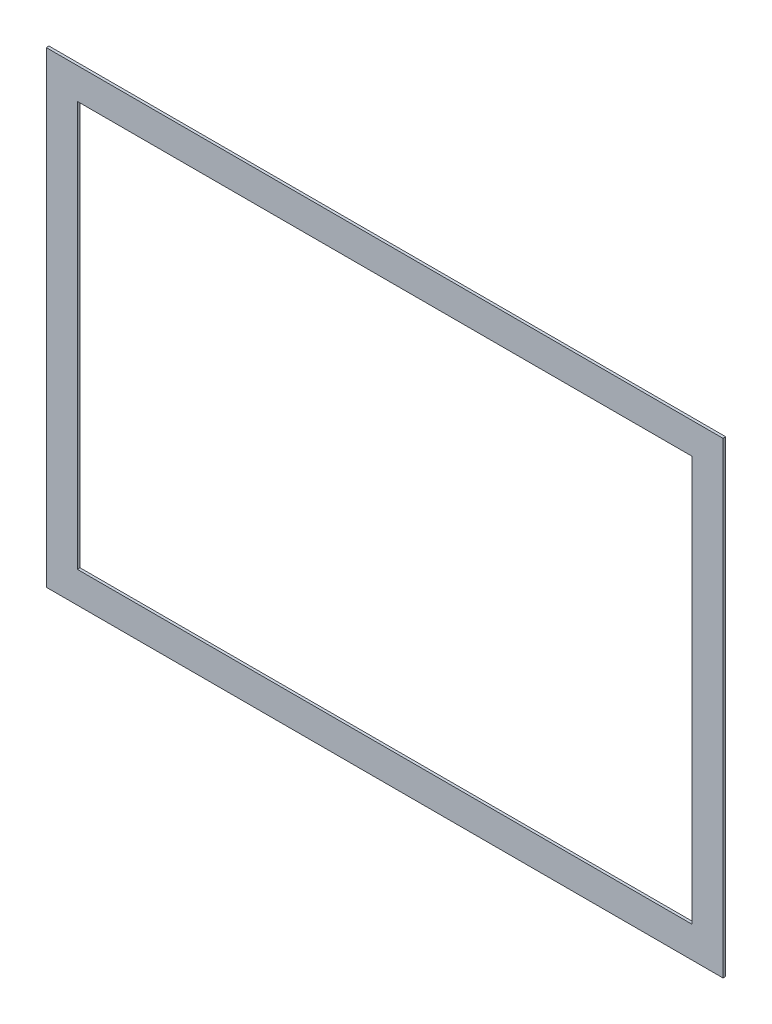
from build123d import *

# Parameters (mm, degrees)
IZIM1_W            = 501
IZIM1_H            = 346
IZIM1_W_2          = 455
IZIM1_H_2          = 300
TABAN_FLAN_1_DEPTH = 2


# Sheet-metal steps are written as plain solids
with BuildPart() as part:
    # Çizim1 → Taban-Flanş1 (new body)
    with BuildSketch(Plane.XY):
        with Locations((227.5, 150)):
            Rectangle(IZIM1_W, IZIM1_H)
        with Locations((227.5, 150)):
            Rectangle(IZIM1_W_2, IZIM1_H_2, mode=Mode.SUBTRACT)
    extrude(amount=-TABAN_FLAN_1_DEPTH)


solid = part.part
